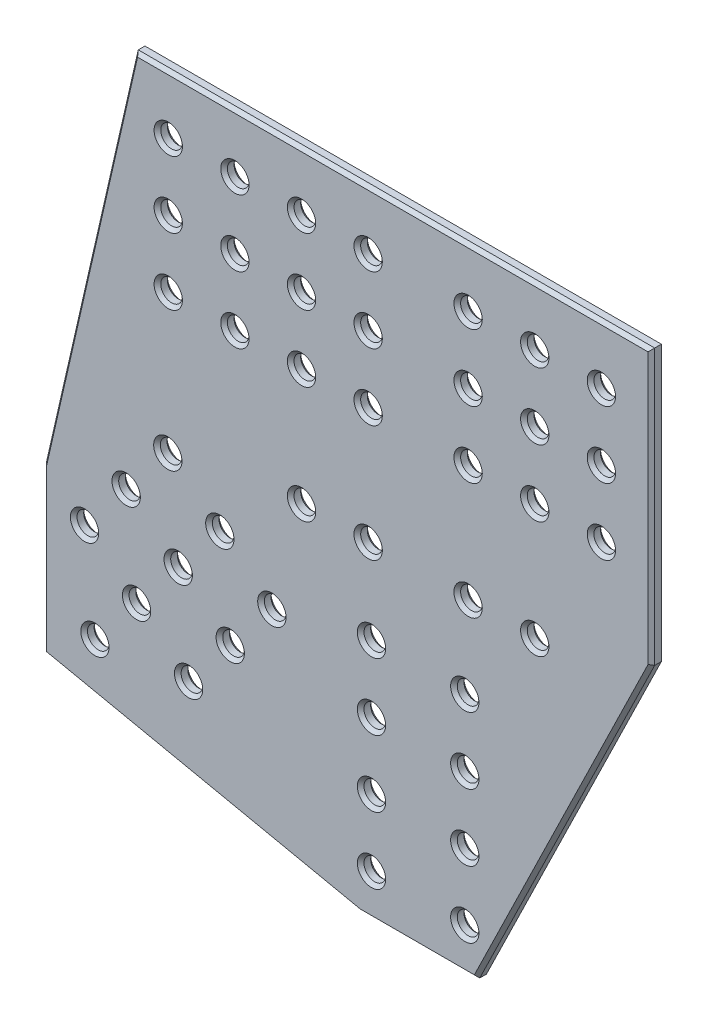
from build123d import *

# Parameters (mm, degrees)
SKETCH_1_R         = 13
EXTRUDE_1536_DEPTH = 16
CHAMFER_2_SIZE     = 4


with BuildPart() as part:
    # 草图1 → Extrude 1536 (new body)
    with BuildSketch(Plane.XY):
        Polygon((730, -330), (520, -760), (380, -760), (0, -680), (0, -482.786642105), (110, 0), (730, 0), align=None)
        with Locations((510, -70)):
            Circle(SKETCH_1_R, mode=Mode.SUBTRACT)
        with Locations((590, -70)):
            Circle(SKETCH_1_R, mode=Mode.SUBTRACT)
        with Locations((670, -70)):
            Circle(SKETCH_1_R, mode=Mode.SUBTRACT)
        with Locations((510, -150)):
            Circle(SKETCH_1_R, mode=Mode.SUBTRACT)
        with Locations((590, -150)):
            Circle(SKETCH_1_R, mode=Mode.SUBTRACT)
        with Locations((670, -150)):
            Circle(SKETCH_1_R, mode=Mode.SUBTRACT)
        with Locations((510, -230)):
            Circle(SKETCH_1_R, mode=Mode.SUBTRACT)
        with Locations((590, -230)):
            Circle(SKETCH_1_R, mode=Mode.SUBTRACT)
        with Locations((670, -230)):
            Circle(SKETCH_1_R, mode=Mode.SUBTRACT)
        with Locations((230, -230)):
            Circle(SKETCH_1_R, mode=Mode.SUBTRACT)
        with Locations((310, -230)):
            Circle(SKETCH_1_R, mode=Mode.SUBTRACT)
        with Locations((390, -230)):
            Circle(SKETCH_1_R, mode=Mode.SUBTRACT)
        with Locations((230, -150)):
            Circle(SKETCH_1_R, mode=Mode.SUBTRACT)
        with Locations((310, -150)):
            Circle(SKETCH_1_R, mode=Mode.SUBTRACT)
        with Locations((390, -150)):
            Circle(SKETCH_1_R, mode=Mode.SUBTRACT)
        with Locations((230, -70)):
            Circle(SKETCH_1_R, mode=Mode.SUBTRACT)
        with Locations((310, -70)):
            Circle(SKETCH_1_R, mode=Mode.SUBTRACT)
        with Locations((390, -70)):
            Circle(SKETCH_1_R, mode=Mode.SUBTRACT)
        with Locations((150, -70)):
            Circle(SKETCH_1_R, mode=Mode.SUBTRACT)
        with Locations((150, -150)):
            Circle(SKETCH_1_R, mode=Mode.SUBTRACT)
        with Locations((150, -230)):
            Circle(SKETCH_1_R, mode=Mode.SUBTRACT)
        with Locations((590, -370)):
            Circle(SKETCH_1_R, mode=Mode.SUBTRACT)
        with Locations((510, -370)):
            Circle(SKETCH_1_R, mode=Mode.SUBTRACT)
        with Locations((390, -370)):
            Circle(SKETCH_1_R, mode=Mode.SUBTRACT)
        with Locations((310, -370)):
            Circle(SKETCH_1_R, mode=Mode.SUBTRACT)
        with Locations((506, -470)):
            Circle(SKETCH_1_R, mode=Mode.SUBTRACT)
        with Locations((506, -550)):
            Circle(SKETCH_1_R, mode=Mode.SUBTRACT)
        with Locations((506, -630)):
            Circle(SKETCH_1_R, mode=Mode.SUBTRACT)
        with Locations((506, -710)):
            Circle(SKETCH_1_R, mode=Mode.SUBTRACT)
        with Locations((394, -710)):
            Circle(SKETCH_1_R, mode=Mode.SUBTRACT)
        with Locations((394, -630)):
            Circle(SKETCH_1_R, mode=Mode.SUBTRACT)
        with Locations((394, -550)):
            Circle(SKETCH_1_R, mode=Mode.SUBTRACT)
        with Locations((394, -470)):
            Circle(SKETCH_1_R, mode=Mode.SUBTRACT)
        with Locations((149.479377198, -397.484050539)):
            Circle(SKETCH_1_R, mode=Mode.SUBTRACT)
        with Locations((99.493096694, -459.945012437)):
            Circle(SKETCH_1_R, mode=Mode.SUBTRACT)
        with Locations((49.506816189, -522.405974336)):
            Circle(SKETCH_1_R, mode=Mode.SUBTRACT)
        with Locations((61.981497584, -634.85321674)):
            Circle(SKETCH_1_R, mode=Mode.SUBTRACT)
        with Locations((111.967778088, -572.392254841)):
            Circle(SKETCH_1_R, mode=Mode.SUBTRACT)
        with Locations((161.954058593, -509.931292942)):
            Circle(SKETCH_1_R, mode=Mode.SUBTRACT)
        with Locations((211.940339097, -447.470331043)):
            Circle(SKETCH_1_R, mode=Mode.SUBTRACT)
        with Locations((174.428739987, -622.378535345)):
            Circle(SKETCH_1_R, mode=Mode.SUBTRACT)
        with Locations((224.415020492, -559.917573446)):
            Circle(SKETCH_1_R, mode=Mode.SUBTRACT)
        with Locations((274.401300996, -497.456611548)):
            Circle(SKETCH_1_R, mode=Mode.SUBTRACT)
    extrude(amount=EXTRUDE_1536_DEPTH)

    # 倒角2
    chamfer_2_edges = [part.edges().sort_by_distance(p)[0] for p in [
        (381, -470, 0),
        (211.415020492, -559.917573446, 0),
        (198.940339097, -447.470331043, 0),
        (98.967778088, -572.392254841, 0),
        (36.506816189, -522.405974336, 0),
        (136.479377198, -397.484050539, 0),
        (381, -630, 0),
        (493, -710, 0),
        (493, -550, 0),
        (297, -370, 0),
        (497, -370, 0),
        (137, -230, 0),
        (137, -70, 0),
        (297, -70, 0),
        (377, -150, 0),
        (217, -150, 0),
        (297, -230, 0),
        (657, -230, 0),
        (497, -230, 0),
        (577, -150, 0),
        (657, -70, 0),
        (497, -70, 0),
        (420, 0, 0),
        (55, -241.393321053, 0),
        (0, -581.393321053, 0),
        (190, -720, 0),
        (450, -760, 0),
        (625, -545, 0),
        (730, -165, 0),
        (577, -70, 0),
        (497, -150, 0),
        (657, -150, 0),
        (577, -230, 0),
        (217, -230, 0),
        (377, -230, 0),
        (297, -150, 0),
        (217, -70, 0),
        (377, -70, 0),
        (137, -150, 0),
        (577, -370, 0),
        (377, -370, 0),
        (493, -470, 0),
        (493, -630, 0),
        (381, -710, 0),
        (381, -550, 0),
        (86.493096694, -459.945012437, 0),
        (48.981497584, -634.85321674, 0),
        (148.954058593, -509.931292942, 0),
        (161.428739987, -622.378535345, 0),
        (261.401300996, -497.456611548, 0),
        (381, -470, 16),
        (211.415020492, -559.917573446, 16),
        (198.940339097, -447.470331043, 16),
        (98.967778088, -572.392254841, 16),
        (36.506816189, -522.405974336, 16),
        (136.479377198, -397.484050539, 16),
        (381, -630, 16),
        (493, -710, 16),
        (493, -550, 16),
        (297, -370, 16),
        (497, -370, 16),
        (137, -230, 16),
        (137, -70, 16),
        (297, -70, 16),
        (377, -150, 16),
        (217, -150, 16),
        (297, -230, 16),
        (657, -230, 16),
        (497, -230, 16),
        (577, -150, 16),
        (657, -70, 16),
        (497, -70, 16),
        (625, -545, 16),
        (450, -760, 16),
        (190, -720, 16),
        (0, -581.393321053, 16),
        (55, -241.393321053, 16),
        (420, 0, 16),
        (730, -165, 16),
        (577, -70, 16),
        (497, -150, 16),
        (657, -150, 16),
        (577, -230, 16),
        (217, -230, 16),
        (377, -230, 16),
        (297, -150, 16),
        (217, -70, 16),
        (377, -70, 16),
        (137, -150, 16),
        (577, -370, 16),
        (377, -370, 16),
        (493, -470, 16),
        (493, -630, 16),
        (381, -710, 16),
        (381, -550, 16),
        (86.493096694, -459.945012437, 16),
        (48.981497584, -634.85321674, 16),
        (148.954058593, -509.931292942, 16),
        (161.428739987, -622.378535345, 16),
        (261.401300996, -497.456611548, 16),
    ]]
    chamfer(chamfer_2_edges, length=CHAMFER_2_SIZE)


solid = part.part
